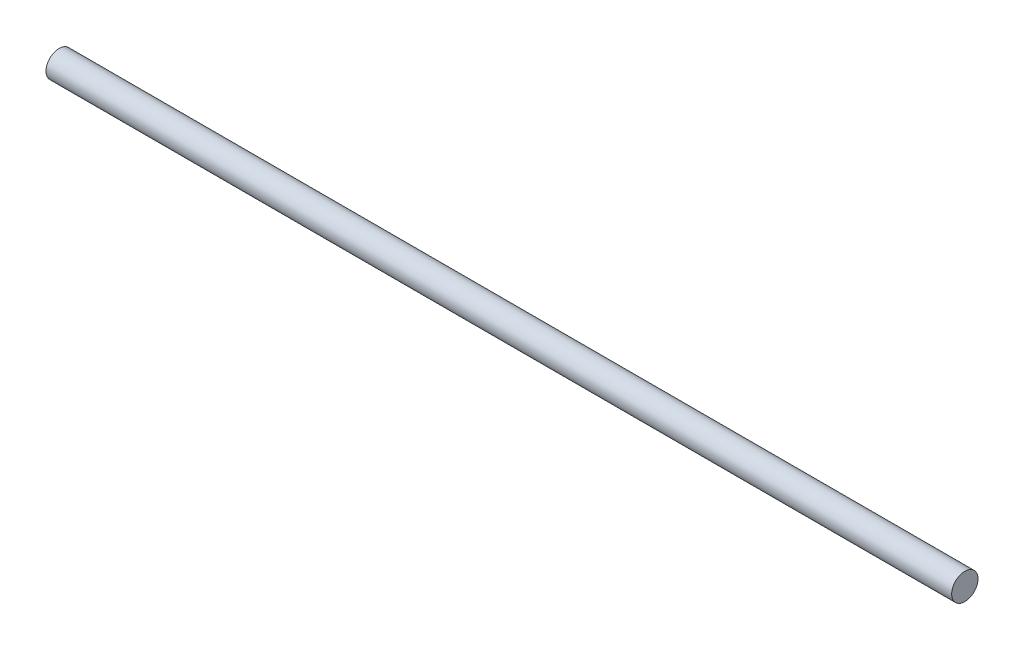
from build123d import *

# Parameters (mm, degrees)
BOSS_EXTRUDE1_OUTLINE_R = 3.175
BOSS_EXTRUDE1_DEPTH     = 218.44


# Read off the part's stored shape, not the designer's step: Boss-Extrude1
with BuildPart() as part:
    # Boss-Extrude1 outline → Boss-Extrude1 (new body)
    with BuildSketch(Plane(origin=(-98.013718438, 0, 0), x_dir=(0, 0, -1), z_dir=(1, 0, 0))):
        with Locations((-21.267819308, -276.062087489)):
            Circle(BOSS_EXTRUDE1_OUTLINE_R)
    extrude(amount=BOSS_EXTRUDE1_DEPTH)


solid = part.part
